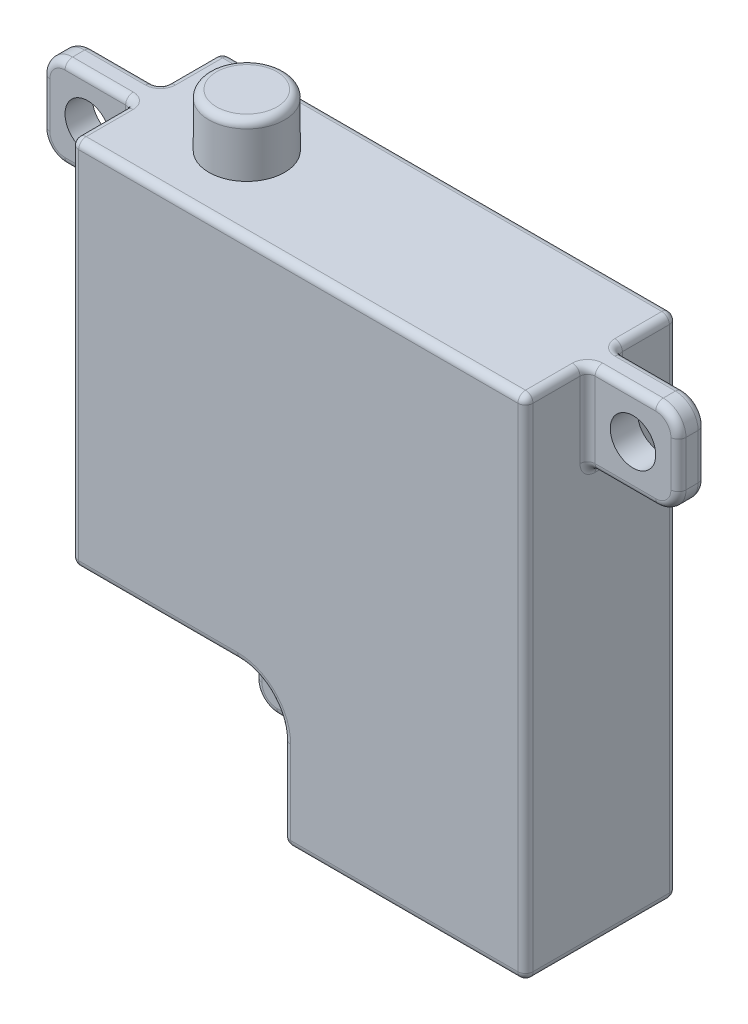
from build123d import *

# Parameters (mm, degrees)
BOSS_EXTRUDE1_DEPTH = 10
SKETCH2_W           = 1.8
SKETCH2_H           = 6
BOSS_EXTRUDE2_DEPTH = 6
SKETCH3_W           = 1.8
SKETCH3_H           = 6
BOSS_EXTRUDE3_DEPTH = 6
SKETCH4_W           = 1.8
SKETCH4_H           = 6
BOSS_EXTRUDE4_DEPTH = 6
SKETCH5_R           = 1.5
CUT_EXTRUDE2_DEPTH  = 6
FILLET1_R           = 0.5
SKETCH6_R           = 2.5
BOSS_EXTRUDE5_DEPTH = 3.5
FILLET2_R           = 0.5


with BuildPart() as part:
    # Sketch1 → Boss-Extrude1 (new body)
    with BuildSketch(Plane.XY):
        with BuildLine():
            Line((0, 0), (16, 0))
            Line((16, 0), (16, 33.5))
            Line((16, 33.5), (-14, 33.5))
            Line((-14, 33.5), (-14, 9))
            Line((-14, 9), (-3, 9))
            ThreePointArc((-3, 9), (-0.878679656, 8.121320344), (0, 6))
            Line((0, 6), (0, 0))
        make_face()
    extrude(amount=BOSS_EXTRUDE1_DEPTH)

    # Sketch2 → Boss-Extrude2 (add)
    with BuildSketch(Plane.ZY.offset(14)):
        with Locations((5, 30.5)):
            Rectangle(SKETCH2_W, SKETCH2_H)
    extrude(amount=BOSS_EXTRUDE2_DEPTH)

    # Sketch3 → Boss-Extrude3 (add)
    with BuildSketch(Plane(origin=(16, 0, 0), x_dir=(0, 0, -1), z_dir=(1, 0, 0))):
        with Locations((-5, 30.5)):
            Rectangle(SKETCH3_W, SKETCH3_H)
    extrude(amount=BOSS_EXTRUDE3_DEPTH)

    # Sketch4 → Boss-Extrude4 (add)
    with BuildSketch(Plane.ZY):
        with Locations((5, 6)):
            Rectangle(SKETCH4_W, SKETCH4_H)
    extrude(amount=BOSS_EXTRUDE4_DEPTH)

    # Sketch5 → Cut-Extrude2 (cut)
    with BuildSketch(Plane.XY.offset(5.9)):
        with BuildLine():
            Line((22, 33.5), (20.5, 33.5))
            ThreePointArc((20.5, 33.5), (21.560660172, 33.060660172), (22, 32))
            Line((22, 32), (22, 33.5))
        make_face()
        with BuildLine():
            ThreePointArc((22, 29), (21.560660172, 27.939339828), (20.5, 27.5))
            Line((20.5, 27.5), (22, 27.5))
            Line((22, 27.5), (22, 29))
        make_face()
        with BuildLine():
            ThreePointArc((-4.5, 3), (-5.560660172, 3.439339828), (-6, 4.5))
            Line((-6, 4.5), (-6, 3))
            Line((-6, 3), (-4.5, 3))
        make_face()
        with Locations((-17, 30.5)):
            Circle(SKETCH5_R)
        with Locations((19, 30.5)):
            Circle(SKETCH5_R)
        with Locations((-3, 6)):
            Circle(SKETCH5_R)
        with BuildLine():
            Line((-20, 33.5), (-20, 32))
            ThreePointArc((-20, 32), (-19.560660172, 33.060660172), (-18.5, 33.5))
            Line((-18.5, 33.5), (-20, 33.5))
        make_face()
        with BuildLine():
            ThreePointArc((-18.5, 27.5), (-19.560660172, 27.939339828), (-20, 29))
            Line((-20, 29), (-20, 27.5))
            Line((-20, 27.5), (-18.5, 27.5))
        make_face()
    extrude(amount=-CUT_EXTRUDE2_DEPTH, mode=Mode.SUBTRACT)

    # Fillet1
    fillet1_edges = [part.edges().sort_by_distance(p)[0] for p in [
        (-6, 9, 5),
        (0, 3, 5),
        (-16.25, 27.5, 5.9),
        (-19.560660172, 27.939339828, 5.9),
        (-20, 30.5, 5.9),
        (-19.560660172, 33.060660172, 5.9),
        (-16.25, 27.5, 4.1),
        (-19.560660172, 27.939339828, 4.1),
        (-20, 30.5, 4.1),
        (-19.560660172, 33.060660172, 4.1),
        (18.25, 27.5, 4.1),
        (21.560660172, 27.939339828, 4.1),
        (22, 30.5, 4.1),
        (21.560660172, 33.060660172, 4.1),
        (18.25, 27.5, 5.9),
        (21.560660172, 27.939339828, 5.9),
        (22, 30.5, 5.9),
        (21.560660172, 33.060660172, 5.9),
        (16, 27.5, 5),
        (16, 30.5, 4.1),
        (16, 30.5, 5.9),
        (-0.878679656, 8.121320344, 10),
        (-8.5, 9, 10),
        (16, 16.75, 10),
        (0, 3, 10),
        (-2.25, 3, 4.1),
        (0, 4.5, 4.1),
        (-0.878679656, 8.121320344, 4.1),
        (-4.5, 9, 4.1),
        (-6, 6.75, 4.1),
        (-5.560660172, 3.439339828, 4.1),
        (-4.5, 6, 4.1),
        (-6, 6.75, 5.9),
        (-4.5, 9, 5.9),
        (-0.878679656, 8.121320344, 5.9),
        (0, 4.5, 5.9),
        (-2.25, 3, 5.9),
        (-5.560660172, 3.439339828, 5.9),
        (-4.5, 6, 5.9),
        (-14, 27.5, 5),
        (-14, 30.5, 5.9),
        (-14, 21.25, 10),
        (-14, 9, 5),
        (-14, 30.5, 4.1),
        (0, 0, 5),
        (8, 0, 10),
        (16, 0, 5),
        (16, 33.5, 7.95),
        (1, 33.5, 10),
        (-14, 33.5, 7.95),
        (-16.25, 33.5, 5.9),
        (-16.25, 33.5, 4.1),
        (-14, 33.5, 2.05),
        (16, 33.5, 2.05),
        (18.25, 33.5, 4.1),
        (18.25, 33.5, 5.9),
        (8, 0, 0),
        (16, 16.75, 0),
        (1, 33.5, 0),
        (-14, 21.25, 0),
        (-8.5, 9, 0),
        (-0.878679656, 8.121320344, 0),
        (0, 3, 0),
    ]]
    fillet(fillet1_edges, radius=FILLET1_R)

    # Sketch6 → Boss-Extrude5 (add)
    with BuildSketch(Plane(origin=(0, 33.5, 0), x_dir=(1, 0, 0), z_dir=(0, 1, 0))):
        with Locations((-7.4, -5)):
            Circle(SKETCH6_R)
    extrude(amount=BOSS_EXTRUDE5_DEPTH)

    # Fillet2
    fillet2_edges = [part.edges().sort_by_distance(p)[0] for p in [
        (-9.9, 37, 5),
    ]]
    fillet(fillet2_edges, radius=FILLET2_R)


solid = part.part
